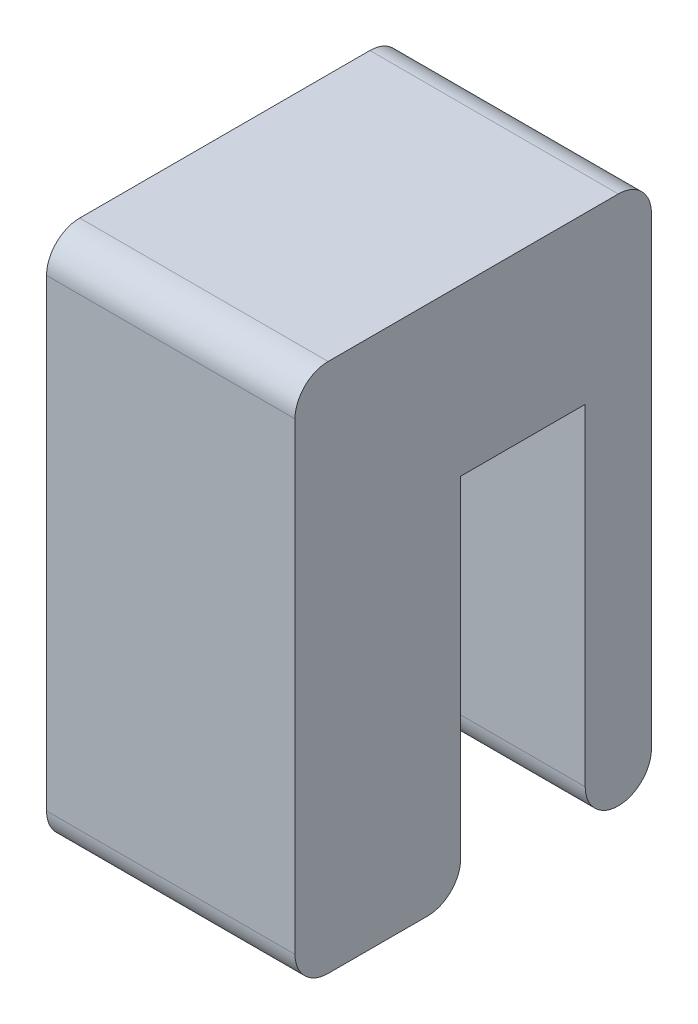
from build123d import *

# Parameters (mm, degrees)
BOSS_EXTRUDE1_DEPTH = 19.05
FILLET3_R           = 2.54


with BuildPart() as part:
    # Sketch1 → Boss-Extrude1 (new body)
    with BuildSketch(Plane(origin=(0, 0, 0), x_dir=(0, 0, -1), z_dir=(1, 0, 0))):
        Polygon((0, -27.94), (0, 0), (9.5504, 0), (9.5504, -27.94), (14.6304, -27.94), (14.6304, 12.7), (-12.7, 12.7), (-12.7, -27.94), align=None)
    extrude(amount=BOSS_EXTRUDE1_DEPTH)

    # Fillet3
    fillet3_edges = [part.edges().sort_by_distance(p)[0] for p in [
        (9.525, -27.94, 12.7),
        (9.525, 12.7, 12.7),
        (9.525, 12.7, -14.6304),
        (9.525, -27.94, -14.6304),
        (9.525, -27.94, -9.5504),
        (9.525, -27.94, 0),
    ]]
    fillet(fillet3_edges, radius=FILLET3_R - 0.0001)  # a hair under: the kernel refuses the full size


solid = part.part
